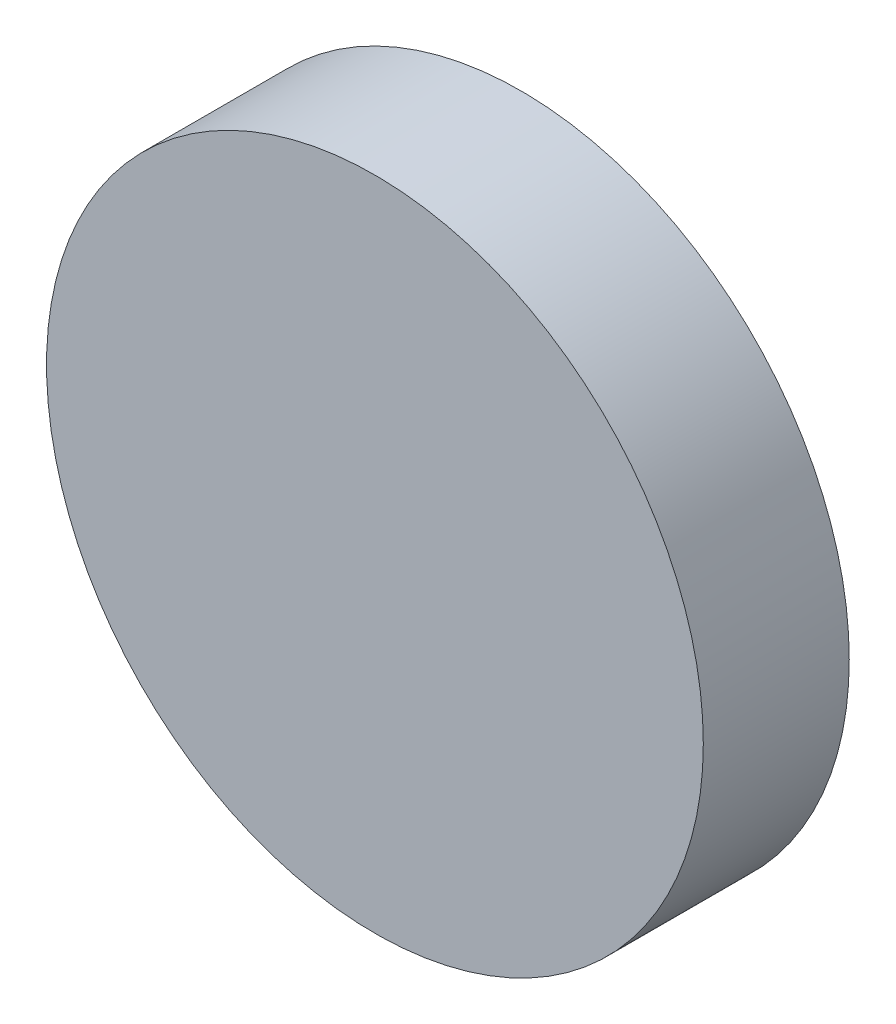
from build123d import *

# Parameters (mm, degrees)
SKETCH1_R           = 27
SKETCH1_R_2         = 25.15
BOSS_EXTRUDE1_DEPTH = 10
SKETCH2_R           = 27
BOSS_EXTRUDE3_DEPTH = 2


with BuildPart() as part:
    # Sketch1 → Boss-Extrude1 (new body)
    with BuildSketch(Plane.XY):
        Circle(SKETCH1_R)
        Circle(SKETCH1_R_2, mode=Mode.SUBTRACT)
    extrude(amount=BOSS_EXTRUDE1_DEPTH)

    # Sketch2 → Boss-Extrude3 (add)
    with BuildSketch(Plane.XY.offset(10)):
        Circle(SKETCH2_R)
    extrude(amount=BOSS_EXTRUDE3_DEPTH)


solid = part.part
